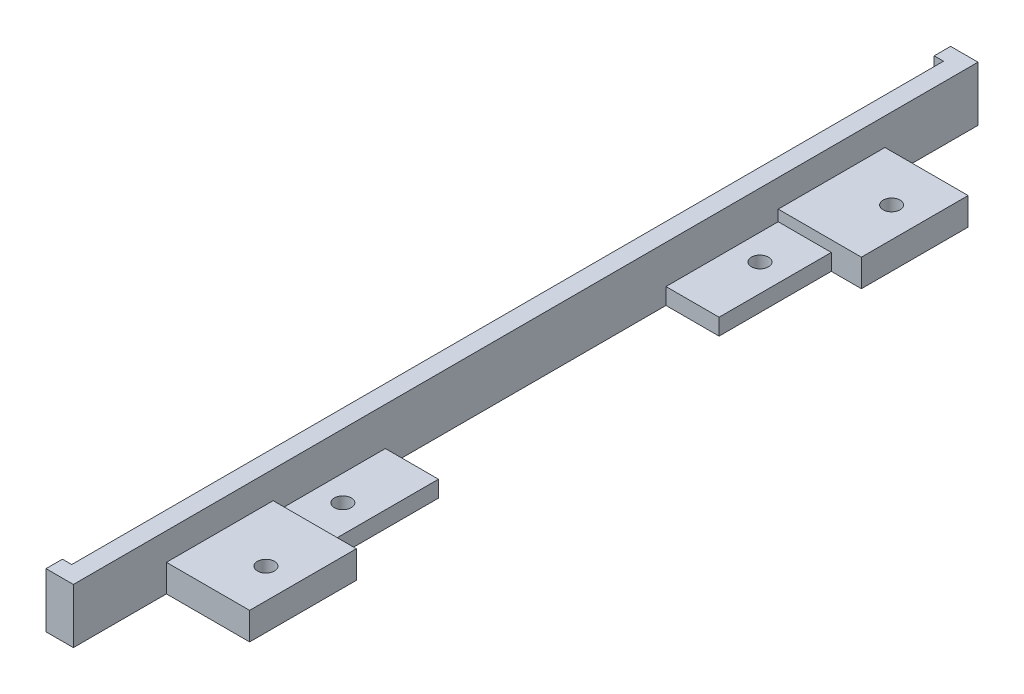
from build123d import *

# Parameters (mm, degrees)
SKETCH1_R           = 1.55
BOSS_EXTRUDE1_DEPTH = 10
SKETCH3_W           = 15.2
SKETCH3_H           = 131.26
CUT_EXTRUDE1_DEPTH  = 5
SKETCH4_W           = 9.7
SKETCH4_H           = 92.26
CUT_EXTRUDE2_DEPTH  = 2
CUT_EXTRUDE4_DEPTH  = 2.3


with BuildPart() as part:
    # Sketch1 → Boss-Extrude1 (new body)
    with BuildSketch(Plane(origin=(0, 0, 0), x_dir=(1, 0, 0), z_dir=(0, 1, 0))):
        Polygon((0, 0), (5, 0), (5, 17), (20.2, 17), (20.2, 36.5), (14.7, 36.5), (14.7, 57), (5, 57), (5, 108.26), (14.7, 108.26), (14.7, 128.76), (20.2, 128.76), (20.2, 148.26), (5, 148.26), (5, 165.26), (0, 165.26), (0, 162.26), (1.7, 162.26), (1.7, 3), (0, 3), align=None)
        with Locations((14.7, 25.48)):
            Circle(SKETCH1_R, mode=Mode.SUBTRACT)
        with Locations((9.7, 44.53)):
            Circle(SKETCH1_R, mode=Mode.SUBTRACT)
        with Locations((9.7, 120.73)):
            Circle(SKETCH1_R, mode=Mode.SUBTRACT)
        with Locations((14.7, 139.78)):
            Circle(SKETCH1_R, mode=Mode.SUBTRACT)
    extrude(amount=BOSS_EXTRUDE1_DEPTH)

    # Sketch3 → Cut-Extrude1 (cut)
    with BuildSketch(Plane(origin=(0, 10, 0), x_dir=(1, 0, 0), z_dir=(0, 1, 0))):
        with Locations((12.6, 82.63)):
            Rectangle(SKETCH3_W, SKETCH3_H)
    extrude(amount=-CUT_EXTRUDE1_DEPTH, mode=Mode.SUBTRACT)

    # Sketch4 → Cut-Extrude2 (cut)
    with BuildSketch(Plane(origin=(0, 5, 0), x_dir=(1, 0, 0), z_dir=(0, 1, 0))):
        with Locations((9.85, 82.63)):
            Rectangle(SKETCH4_W, SKETCH4_H)
    extrude(amount=-CUT_EXTRUDE2_DEPTH, mode=Mode.SUBTRACT)

    # Sketch5 → Cut-Extrude4 (cut)
    with BuildSketch(Plane.XZ):
        Polygon((17.45, -23.89228676), (17.45, -27.06771324), (14.7, -28.655426481), (11.95, -27.06771324), (11.95, -23.89228676), (14.7, -22.304573519), align=None)
        Polygon((11.95, -138.19228676), (11.95, -141.36771324), (14.7, -142.955426481), (17.45, -141.36771324), (17.45, -138.19228676), (14.7, -136.604573519), align=None)
    extrude(amount=-CUT_EXTRUDE4_DEPTH, mode=Mode.SUBTRACT)


solid = part.part
